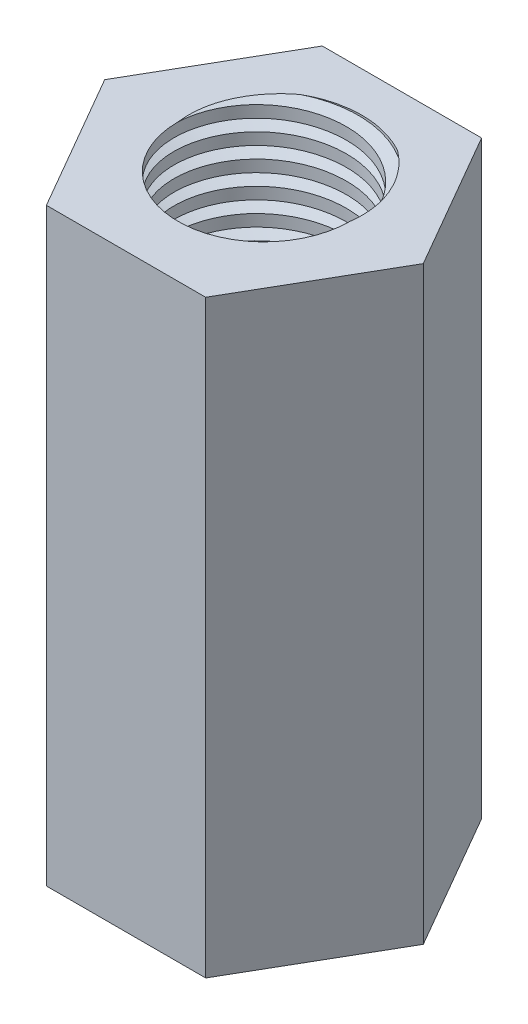
from build123d import *

# Parameters (mm, degrees)
SKETCH_1_R          = 1.46
EXTRUDE_1_DEPTH     = 10
SKETCH_1_3_R        = 1.46
CUT_EXTRUDE_1_DEPTH = 5
SWEEP_2_PITCH       = 0.4
CUT_EXTRUDE1_START  = -5
SKETCH1_R           = 1.46
CUT_EXTRUDE1_DEPTH  = 5


with BuildPart() as part:
    # 草图1 → 凸台-拉伸1 (new body)
    # profile 1 of 2: a face of its own
    with BuildSketch(Plane(origin=(0, 0, 0), x_dir=(1, 0, 0), z_dir=(0, 1, 0))):
        Polygon((-2.70199926, 0), (-1.35099963, -2.34), (1.35099963, -2.34), (2.70199926, 0), (1.35099963, 2.34), (-1.35099963, 2.34), align=None)
        Circle(SKETCH_1_R, mode=Mode.SUBTRACT)
    # profile 2 of 2: a face of its own
    with BuildSketch(Plane(origin=(0, 0, 0), x_dir=(1, 0, 0), z_dir=(0, 1, 0))):
        Circle(SKETCH_1_R)
    extrude(amount=EXTRUDE_1_DEPTH)

    # 草图1<3> → 切除-拉伸1 (cut)
    with BuildSketch(Plane(origin=(0, 0, 0), x_dir=(1, 0, 0), z_dir=(0, 1, 0))):
        with Locations(Location((0, 0, 0), (0, 0, 270))):
            Circle(SKETCH_1_3_R)
    extrude(amount=CUT_EXTRUDE_1_DEPTH, mode=Mode.SUBTRACT)

    # 切除-扫描2: arcs per turn and ends read off the stored shape
    # 切除-扫描2: the profile of 草图7 profile screwed along a right-hand helix through 75 turns, 6 arcs to a turn; built about Z, then put on its axis
    sweep_2_z = Axis((0, 0, 0), (0, 0, 1))
    sweep_2_corners = [(1.4597, 0, 0.1001), (1.66, 0, 0.033333333), (1.66, 0, -0.033333333), (1.4597, 0, -0.1001)]
    with BuildLine(mode=Mode.PRIVATE) as sweep_2_profile:
        Line(sweep_2_corners[0], sweep_2_corners[1])
        Line(sweep_2_corners[1], sweep_2_corners[2])
        Line(sweep_2_corners[2], sweep_2_corners[3])
        Line(sweep_2_corners[3], sweep_2_corners[0])
    sweep_2_cap = Face(sweep_2_profile.wire())
    sweep_2_turn_angles = [0, 30, 60, 90, 120, 150, 180, 210, 240, 270, 300, 330, 360]
    sweep_2_turn_weights = [1, 0.8660254037844387, 1, 0.8660254037844387, 1, 0.8660254037844387, 1, 0.8660254037844387, 1, 0.8660254037844387, 1, 0.8660254037844387, 1]
    sweep_2_turn_rails = [Edge.make_bspline([Vector(p[0], p[1], 0).rotate(sweep_2_z, sweep_2_turn_angles[k]) / sweep_2_turn_weights[k] + Vector(0, 0, p[2] + SWEEP_2_PITCH * sweep_2_turn_angles[k] / 360) for k in range(13)], [0, 0, 0, 1, 1, 2, 2, 3, 3, 4, 4, 5, 5, 6, 6, 6], 2, sweep_2_turn_weights) for p in sweep_2_corners]
    sweep_2_turn_sides = [Face.make_surface_from_curves(sweep_2_turn_rails[p[0]], sweep_2_turn_rails[p[1]]) for p in [(0, 1), (1, 2), (2, 3), (3, 0)]]
    sweep_2 = Plane(origin=(0, 0, 0), x_dir=(0, 0, -1), z_dir=(0, 1, 0)) * Solid(Shell([*[p.moved(Location((0, 0, SWEEP_2_PITCH * i))) for i in range(75) for p in sweep_2_turn_sides], sweep_2_cap, sweep_2_cap.rotate(sweep_2_z, 27000).moved(Location((0, 0, SWEEP_2_PITCH * 27000 / 360)))]))
    add(sweep_2, mode=Mode.SUBTRACT)

    # Sketch1 → Cut-Extrude1 (cut)
    with BuildSketch(Plane(origin=(0, 10, 0), x_dir=(1, 0, 0), z_dir=(0, 1, 0)).offset(CUT_EXTRUDE1_START)):
        Circle(SKETCH1_R)
    extrude(amount=CUT_EXTRUDE1_DEPTH, mode=Mode.SUBTRACT)


solid = part.part
